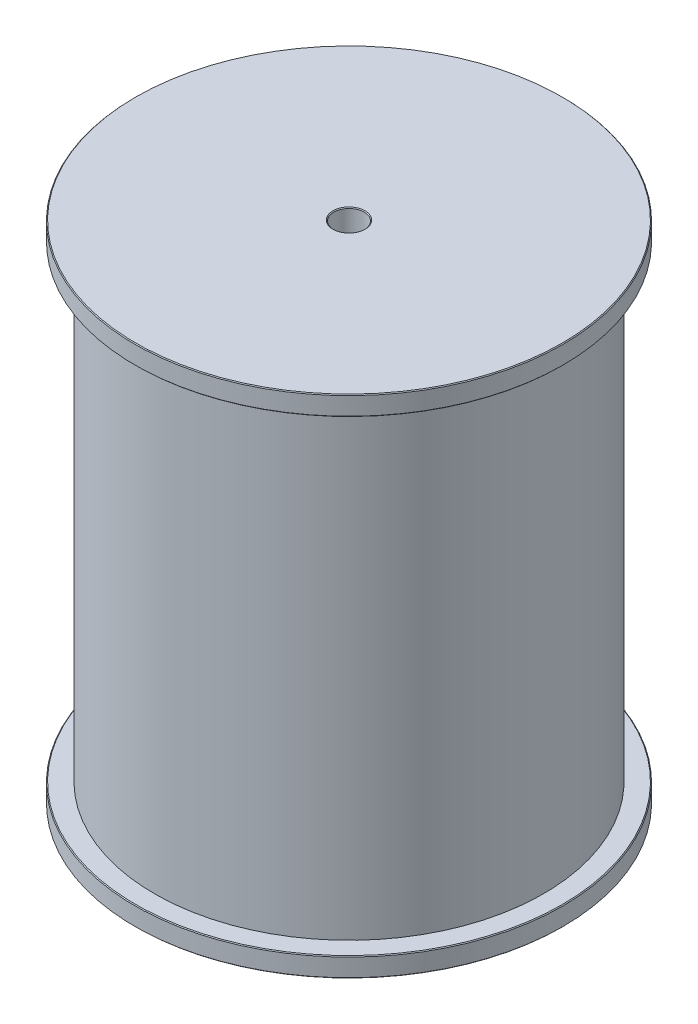
from build123d import *

# Parameters (mm, degrees)
CHAMFER1_SIZE = 0.127


with BuildPart() as part:
    # Sketch1 → Revolve1 (revolve)
    with BuildSketch(Plane.XY):
        Polygon((2.4892, 4.7752), (2.4892, 0), (34.925, 0), (34.925, 3.175), (31.75, 3.175), (31.75, 79.375), (34.925, 79.375), (34.925, 82.55), (2.4892, 82.55), (2.4892, 41.275), (2.4892, 36.4998), align=None)
    revolve(axis=Axis((0, 82.55, 0), (0, -1, 0)))

    # Chamfer1
    chamfer1_edges = [part.edges().sort_by_distance(p)[0] for p in [
        (-34.925, 79.375, 0),
        (-34.925, 3.175, 0),
        (-2.4892, 0, 0),
        (-34.925, 0, 0),
        (-34.925, 82.55, 0),
        (-2.4892, 82.55, 0),
    ]]
    chamfer(chamfer1_edges, length=CHAMFER1_SIZE)


solid = part.part
